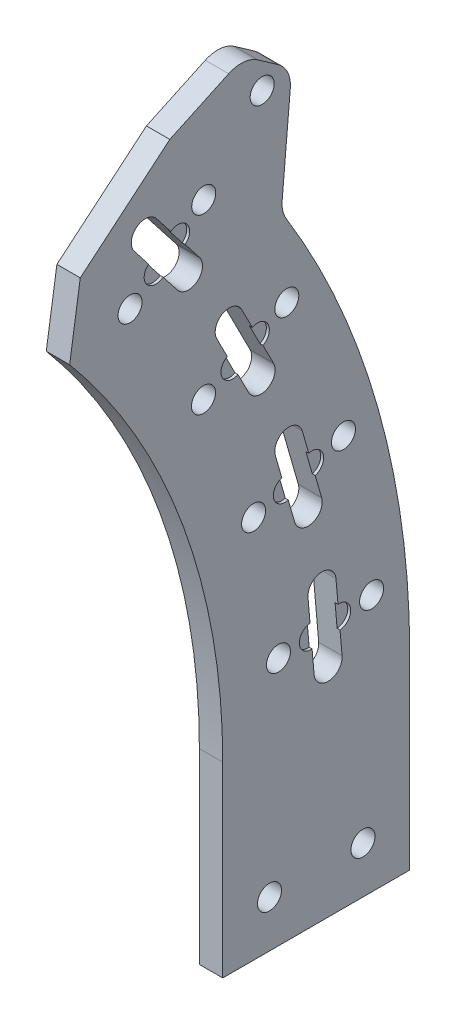
from build123d import *

# Parameters (mm, degrees)
SKETCH1_R               = 3.2639
BOSS_EXTRUDE1_DEPTH     = 6.35
SKETCH6_R               = 3.2639
CUT_EXTRUDE1_DEPTH      = 276.538738431
CUT_EXTRUDE2_START      = -0.79375
CUT_EXTRUDE2_DEPTH      = 10.82675
CIRPATTERN1_COUNT       = 4
CIRPATTERN1_ANGLE       = 33
BOSS_EXTRUDE2_START     = -6.35
BOSS_EXTRUDE2_DEPTH     = 6.35
CUT_EXTRUDE3_DEPTH      = 281.886292305
CUT_EXTRUDE3_DEPTH_BACK = 281.886292305
SKETCH9_R               = 3.2639
FILLET2_R               = 7.9375


with BuildPart() as part:
    # Sketch1 → Boss-Extrude1 (new body)
    with BuildSketch(Plane(origin=(0, 0, 0), x_dir=(0, 0, -1), z_dir=(1, 0, 0))):
        with BuildLine():
            Line((177.8, 0), (177.8, -50.8))
            Line((177.8, -50.8), (228.6, -50.8))
            Line((228.6, -50.8), (228.6, 0))
            ThreePointArc((228.6, 0), (214.813733112, 78.185804764), (175.117759697, 146.941247574))
            Line((175.117759697, 146.941247574), (163.413376386, 153.69877643))
            Line((163.413376386, 153.69877643), (139.091465317, 133.290269822))
            Line((139.091465317, 133.290269822), (136.202701987, 114.287637002))
            ThreePointArc((136.202701987, 114.287637002), (167.077347976, 60.811181483), (177.8, 0))
        make_face()
        with Locations((190.5, -38.1)):
            Circle(SKETCH1_R, mode=Mode.SUBTRACT)
        with Locations((215.9, -38.1)):
            Circle(SKETCH1_R, mode=Mode.SUBTRACT)
    extrude(amount=BOSS_EXTRUDE1_DEPTH)

    # Sketch6 → Cut-Extrude1 (cut, through all)
    with BuildSketch(Plane(origin=(6.35, 0, 0), x_dir=(0, 0, -1), z_dir=(1, 0, 0))):
        with Locations((192.938008153, 16.879888477)):
            Circle(SKETCH6_R)
        with Locations((218.241353484, 19.093644342)):
            Circle(SKETCH6_R)
        with Locations((186.172358961, 53.384064888)):
            Circle(SKETCH6_R)
        with Locations((210.588406038, 60.385253726)):
            Circle(SKETCH6_R)
        with Locations((172.565688572, 87.926610037)):
            Circle(SKETCH6_R)
        with Locations((195.197254287, 99.45796873)):
            Circle(SKETCH6_R)
        with Locations((152.617982705, 119.238236234)):
            Circle(SKETCH6_R)
        with Locations((172.633455846, 134.876037707)):
            Circle(SKETCH6_R)
        with BuildLine():
            Line((192.092529624, 64.990498635), (197.343421252, 46.678463327))
            ThreePointArc((197.343421252, 46.678463327), (202.056006639, 44.066234591), (204.668235375, 48.778819979))
            Line((204.668235375, 48.778819979), (199.417343747, 67.090855286))
            ThreePointArc((199.417343747, 67.090855286), (194.704758359, 69.703084022), (192.092529624, 64.990498635))
        make_face()
        with BuildLine():
            Line((176.162477062, 100.449422723), (184.810996082, 83.475748437))
            ThreePointArc((184.810996082, 83.475748437), (189.935434743, 81.810717384), (191.600465797, 86.935156045))
            Line((191.600465797, 86.935156045), (182.951946777, 103.908830331))
            ThreePointArc((182.951946777, 103.908830331), (177.827508115, 105.573861384), (176.162477062, 100.449422723))
        make_face()
        with BuildLine():
            Line((200.964020569, 27.143457529), (202.624337469, 8.16594853))
            ThreePointArc((202.624337469, 8.16594853), (206.751902648, 4.70251011), (210.215341068, 8.83007529))
            Line((210.215341068, 8.83007529), (208.555024169, 27.807584289))
            ThreePointArc((208.555024169, 27.807584289), (204.427458989, 31.271022709), (200.964020569, 27.143457529))
        make_face()
        with BuildLine():
            Line((159.763864694, 136.908609619), (171.492215799, 121.897004763))
            ThreePointArc((171.492215799, 121.897004763), (170.835565049, 116.549013571), (165.487573857, 117.205664321))
            Line((165.487573857, 117.205664321), (153.759222752, 132.217269177))
            ThreePointArc((153.759222752, 132.217269177), (154.415873502, 137.56526037), (159.763864694, 136.908609619))
        make_face()
    extrude(amount=-CUT_EXTRUDE1_DEPTH, mode=Mode.SUBTRACT)

    # Sketch8 → Cut-Extrude2 (cut)
    with BuildSketch(Plane(origin=(6.35, 15.551634957, -177.756000954), x_dir=(0, 0.08715574274765883, -0.9961946980917454), z_dir=(1, 0, 0)).offset(CUT_EXTRUDE2_START)):
        with BuildLine():
            Line((31.75, 3.175), (24.13, 3.175))
            ThreePointArc((24.13, 3.175), (20.955, 0), (24.13, -3.175))
            Line((24.13, -3.175), (31.75, -3.175))
            ThreePointArc((31.75, -3.175), (34.925, 0), (31.75, 3.175))
        make_face()
    cut_extrude2 = extrude(amount=CUT_EXTRUDE2_DEPTH, mode=Mode.SUBTRACT)

    # CirPattern1: Cut-Extrude2 ×4 about axis
    cirpattern1_axis = Axis((6.35, 0, 0), (1, 0, 0))
    for i in range(1, CIRPATTERN1_COUNT):
        add(cut_extrude2.rotate(cirpattern1_axis, i * CIRPATTERN1_ANGLE / (CIRPATTERN1_COUNT - 1)), mode=Mode.SUBTRACT)

    # Sketch11 → Boss-Extrude2 (add)
    with BuildSketch(Plane(origin=(6.35, 0, 0), x_dir=(0, 0, -1), z_dir=(1, 0, 0)).offset(BOSS_EXTRUDE2_START)):
        with BuildLine():
            Line((183.556066953, 163.091467297), (163.413376386, 153.69877643))
            Line((163.413376386, 153.69877643), (175.117759697, 146.941247574))
            ThreePointArc((175.117759697, 146.941247574), (184.855029121, 134.486349525), (193.708175574, 121.388231372))
            Line((193.708175574, 121.388231372), (196.560105656, 153.98594137))
            Line((196.560105656, 153.98594137), (183.556066953, 163.091467297))
        make_face()
    extrude(amount=BOSS_EXTRUDE2_DEPTH)

    # Sketch9 → Cut-Extrude3 (cut, two sides: drawn at the far end of the back side and taken through both)
    with BuildSketch(Plane(origin=(6.35, 0, 0), x_dir=(0, 0, -1), z_dir=(1, 0, 0)).offset(-CUT_EXTRUDE3_DEPTH_BACK)):
        with Locations((188.512295871, 152.654247257)):
            Circle(SKETCH9_R)
    extrude(amount=CUT_EXTRUDE3_DEPTH + CUT_EXTRUDE3_DEPTH_BACK, mode=Mode.SUBTRACT)

    # Fillet2
    fillet2_edges = [part.edges().sort_by_distance(p)[0] for p in [
        (3.175, 153.98594137, -196.560105656),
        (3.175, 163.091467297, -183.556066953),
        (3.175, 121.388231372, -193.708175574),
    ]]
    fillet(fillet2_edges, radius=FILLET2_R)


solid = part.part
